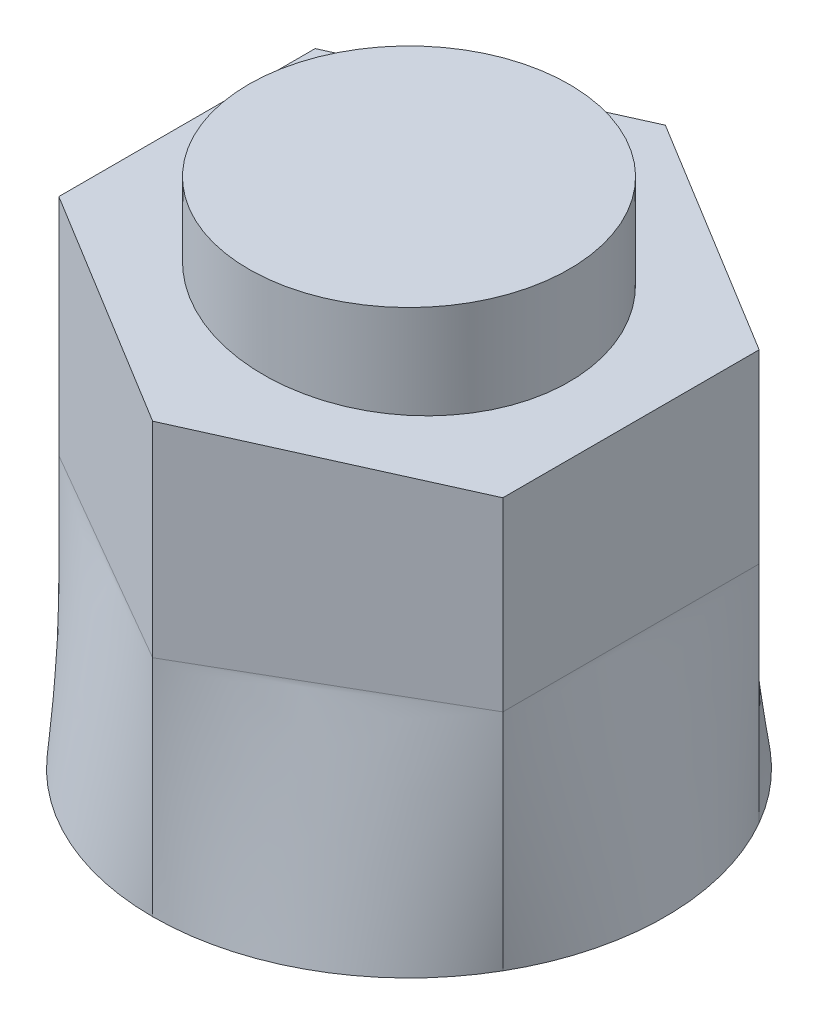
from build123d import *

# Parameters (mm, degrees)
BOSS_EXTRUDE1_DEPTH      = 35
DRAFT3_START             = 66.714465374
DRAFT3_OUTLINE_W         = 72
DRAFT3_OUTLINE_H         = 84
DRAFT3_DEPTH             = 6.038326985
BOSS_EXTRUDE3_DEPTH      = 10
BOSS_EXTRUDE3_DEPTH_BACK = 10
SKETCH8_R                = 25


# Read off the part's stored shape, not the designer's step: Draft3
with BuildPart() as part:
    # Sketch3 for Loft2 → Loft2 section 0
    with BuildSketch(Plane(origin=(0, 0, 0), x_dir=(1, 0, 0), z_dir=(0, 1, 0))):
        with BuildLine():
            # circular arc as an exact rational Bezier (weights 1, cos(half-angle), 1)
            Bezier((-34.641016151, 20), (-23.094010767, 39.999999999), (0, 40), weights=[1, 0.866025404, 1])
            Bezier((0, 40), (23.094010767, 39.999999999), (34.641016151, 20), weights=[1, 0.866025404, 1])
            Bezier((34.641016151, 20), (46.188021536, 0), (34.641016151, -20), weights=[1, 0.866025404, 1])
            Bezier((34.641016151, -20), (23.094010767, -39.999999999), (0, -40), weights=[1, 0.866025404, 1])
            Bezier((0, -40), (-23.094010767, -39.999999999), (-34.641016151, -20), weights=[1, 0.866025404, 1])
            Bezier((-34.641016151, -20), (-46.188021536, 0), (-34.641016151, 20), weights=[1, 0.866025404, 1])
        make_face()
    # Sketch4 → Loft2 section 1
    with BuildSketch(Plane(origin=(0, 35, 0), x_dir=(-1, 0, 0), z_dir=(0, -1, 0))):
        with BuildLine():
            Line((34.641016151, 20), (0, 40))
            Line((0, 40), (-34.641016151, 20))
            Line((-34.641016151, 20), (-34.641016151, -20))
            Line((-34.641016151, -20), (0, -40))
            Line((0, -40), (34.641016151, -20))
            Line((34.641016151, -20), (34.641016151, 20))
        make_face()
    loft()

    # Sketch7 → Boss-Extrude1 (add)
    with BuildSketch(Plane(origin=(0, 35, 0), x_dir=(1, 0, 0), z_dir=(0, 1, 0))):
        Polygon((-34.641016151, 20), (-34.641016151, -20), (0, -40), (34.641016151, -20), (34.641016151, 20), (0, 40), align=None)
    extrude(amount=BOSS_EXTRUDE1_DEPTH)

    # Draft3 outline → Draft3 (cut)
    with BuildSketch(Plane(origin=(0, 0, 0), x_dir=(0.9961946980917452, -0.08715574274766182, 0), z_dir=(0.08715574274766182, 0.9961946980917452, 0)).offset(DRAFT3_START)):
        with Locations((-6, 0)):
            Rectangle(DRAFT3_OUTLINE_W, DRAFT3_OUTLINE_H)
    extrude(amount=DRAFT3_DEPTH, mode=Mode.SUBTRACT)

    # Sketch8 → Boss-Extrude3 (add, two sides: drawn at the far end of the back side and taken through both)
    with BuildSketch(Plane(origin=(0, 70, 0), x_dir=(1, 0, 0), z_dir=(0, 1, 0)).offset(-BOSS_EXTRUDE3_DEPTH_BACK)):
        with Locations(Location((0, 0, 0), (0, 0, 180))):
            Circle(SKETCH8_R)
    extrude(amount=BOSS_EXTRUDE3_DEPTH + BOSS_EXTRUDE3_DEPTH_BACK)


solid = part.part
